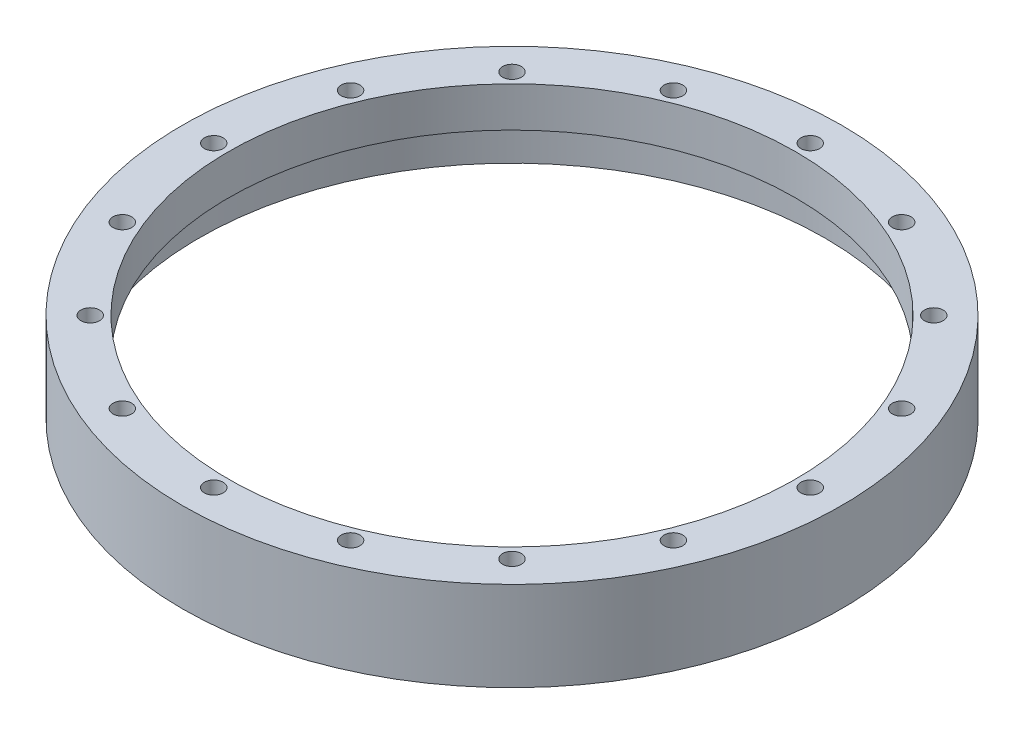
from build123d import *

# Parameters (mm, degrees)
CIRPATTERN1_COUNT = 16


with BuildPart() as part:
    # Sketch1 → Revolve1 (revolve)
    with BuildSketch(Plane.XY):
        Polygon((-49.4665, 0), (-57.4802, 0), (-57.4802, -15.5956), (-54.5719, -15.5956), (-54.5719, -6.985), (-49.4665, -6.985), align=None)
    revolve(axis=Axis((0, 0, 0), (0, 1, 0)))

    # Sketch3 → #4 Clearance Hole1 (revolve, cut)
    with BuildSketch(Plane(origin=(0, 0, -52.0192), x_dir=(0, 0, 1), z_dir=(1, 0, 0))):
        Polygon((0, 0), (0, 11.140574487), (1.63195, 10.16), (1.63195, 0), align=None)
    f_4_clearance_hole1 = revolve(axis=Axis((0, 6.35, -52.0192), (0, -1, 0)), mode=Mode.SUBTRACT)

    # CirPattern1: #4 Clearance Hole1 ×16 about axis
    cirpattern1_axis = Axis((0, 0, 0), (0, -1, 0))
    for i in range(1, CIRPATTERN1_COUNT):
        add(f_4_clearance_hole1.rotate(cirpattern1_axis, i * 360 / CIRPATTERN1_COUNT), mode=Mode.SUBTRACT)


solid = part.part
